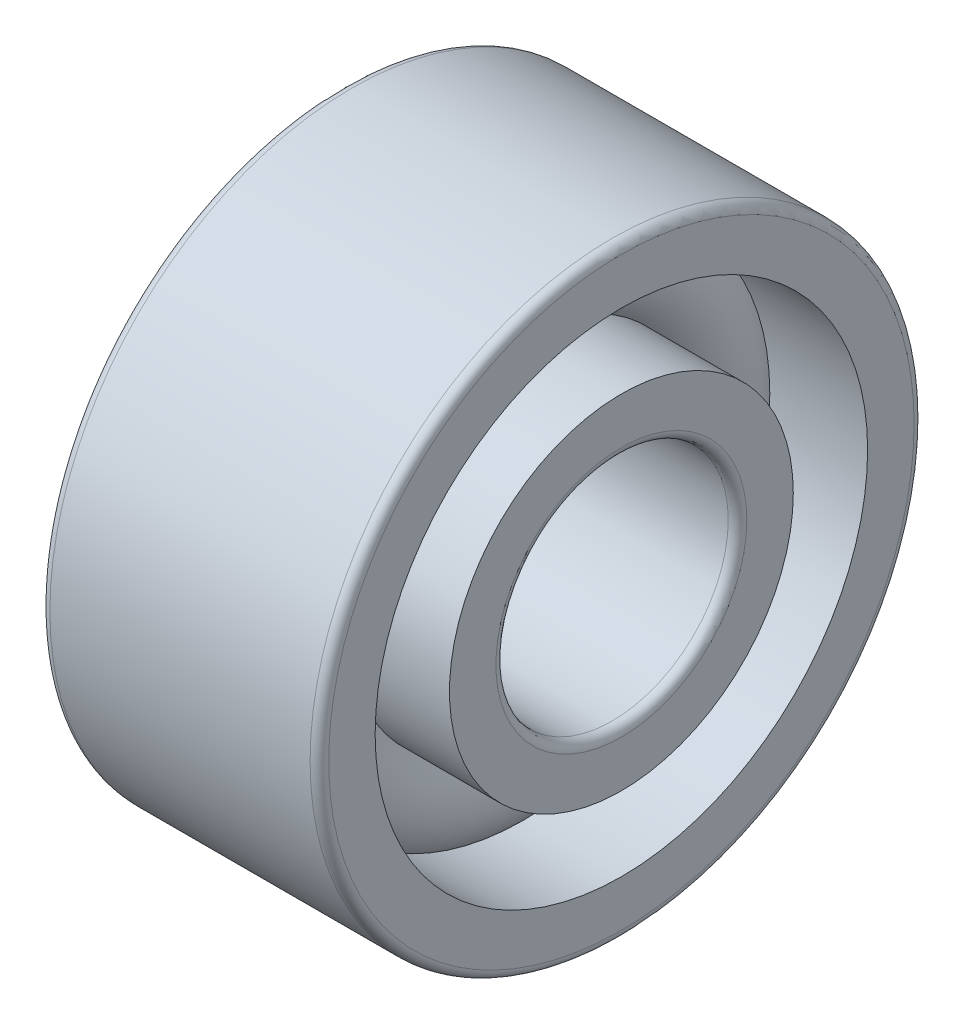
from build123d import *

# Parameters (mm, degrees)
CAGSPISKE_W     = 0.24
CAGSPISKE_H     = 0.4
CAGESPINE_ANGLE = 0.001
BALSIMSKE_R     = 1.2


with BuildPart() as part:
    # CagSpiSke → CageSpine (revolve)
    with BuildSketch(Plane.XY):
        with Locations((0, 4.5)):
            Rectangle(CAGSPISKE_W, CAGSPISKE_H)
    revolve(axis=Axis((-20.6375, 0, 0), (-1, 0, 0)), revolution_arc=CAGESPINE_ANGLE)

    # BalSimSke → BallsSimplified (revolve)
    with BuildSketch(Plane.XY):
        with Locations((0, 4.5)):
            Circle(BALSIMSKE_R)
    revolve(axis=Axis((-10, 0, 0), (1, 0, 0)))

    # InnRacSke → InnerRace (revolve)
    with BuildSketch(Plane.XY):
        with BuildLine():
            Line((-0.860595724, 3.7), (-3, 3.7))
            Line((-3, 3.7), (-3, 2.7))
            ThreePointArc((-3, 2.7), (-2.941421356, 2.558578644), (-2.8, 2.5))
            Line((-2.8, 2.5), (2.8, 2.5))
            ThreePointArc((2.8, 2.5), (2.941421356, 2.558578644), (3, 2.7))
            Line((3, 2.7), (3, 3.7))
            Line((3, 3.7), (0.860595724, 3.7))
            ThreePointArc((0.860595724, 3.7), (0, 3.325), (-0.860595724, 3.7))
        make_face()
    revolve(axis=Axis((-20.6375, 0, 0), (1, 0, 0)))

    # OutRacSke → OuterRace (revolve)
    with BuildSketch(Plane.XY):
        with BuildLine():
            Line((-0.860595724, 5.3), (-3, 5.3))
            Line((-3, 5.3), (-3, 6.3))
            ThreePointArc((-3, 6.3), (-2.941421356, 6.441421356), (-2.8, 6.5))
            Line((-2.8, 6.5), (2.8, 6.5))
            ThreePointArc((2.8, 6.5), (2.941421356, 6.441421356), (3, 6.3))
            Line((3, 6.3), (3, 5.3))
            Line((3, 5.3), (0.860595724, 5.3))
            ThreePointArc((0.860595724, 5.3), (0, 5.675), (-0.860595724, 5.3))
        make_face()
    revolve(axis=Axis((-20.6375, 0, 0), (1, 0, 0)))


solid = part.part
